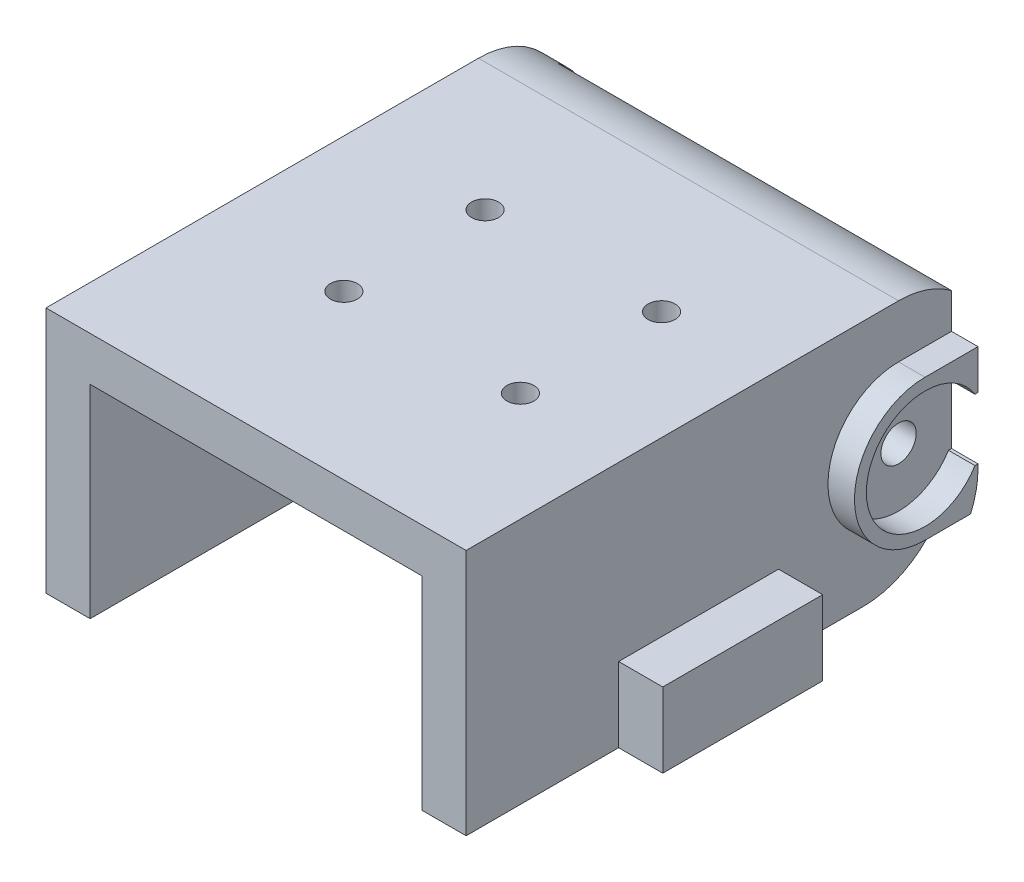
from build123d import *

# Parameters (mm, degrees)
SKETCH1_W           = 47.6
SKETCH1_H           = 28
BOSS_EXTRUDE1_DEPTH = 55
SKETCH3_R           = 2
CUT_EXTRUDE1_DEPTH  = 3
SKETCH4_W           = 18.116069914
SKETCH4_H           = 8.463303816
BOSS_EXTRUDE2_DEPTH = 5
BOSS_EXTRUDE4_DEPTH = 3
BOSS_EXTRUDE5_START = 3
BOSS_EXTRUDE5_DEPTH = 3
SKETCH8_W           = 3
SKETCH8_H           = 28
BOSS_EXTRUDE7_DEPTH = 4
FILLET1_R           = 10
FILLET2_R           = 10
SKETCH9_R           = 1.530150167
CUT_EXTRUDE2_DEPTH  = 69.106093707
SKETCH10_W          = 37.6
SKETCH10_H          = 23
CUT_EXTRUDE4_DEPTH  = 40


with BuildPart() as part:
    # Sketch1 → Boss-Extrude1 (new body)
    with BuildSketch(Plane.XY):
        Rectangle(SKETCH1_W, SKETCH1_H)
    extrude(amount=BOSS_EXTRUDE1_DEPTH)

    # Sketch3 → Cut-Extrude1 (cut)
    with BuildSketch(Plane(origin=(23.8, 0, 0), x_dir=(0, 0, -1), z_dir=(1, 0, 0))):
        with Locations((-6, 0)):
            Circle(SKETCH3_R)
    extrude(amount=-CUT_EXTRUDE1_DEPTH, mode=Mode.SUBTRACT)

    # Sketch4 → Boss-Extrude2 (add)
    with BuildSketch(Plane(origin=(23.8, 0, 0), x_dir=(0, 0, -1), z_dir=(1, 0, 0))):
        with Locations((-28.659392832, -9.768348092)):
            Rectangle(SKETCH4_W, SKETCH4_H)
    extrude(amount=BOSS_EXTRUDE2_DEPTH)

    # Sketch5 → Boss-Extrude4 (add)
    with BuildSketch(Plane(origin=(23.8, 0, 0), x_dir=(0, 0, -1), z_dir=(1, 0, 0))):
        with BuildLine():
            Line((-0.345576953, 3.5), (0, 3.5))
            Line((0, 3.5), (0, 8))
            Line((0, 8), (-6, 8))
            ThreePointArc((-6, 8), (-14, 0), (-6, -8))
            Line((-6, -8), (0, -8))
            Line((0, -8), (0, -3.5))
            Line((0, -3.5), (-0.345576953, -3.5))
            ThreePointArc((-0.345576953, -3.5), (-12.65, 0), (-0.345576953, 3.5))
        make_face()
    extrude(amount=BOSS_EXTRUDE4_DEPTH)

    # Sketch6 → Boss-Extrude5 (add)
    with BuildSketch(Plane.ZY.offset(23.8).offset(BOSS_EXTRUDE5_START)):
        with BuildLine():
            Line((-3.367496998, 3.5), (-1.193747285, 3.5))
            ThreePointArc((-1.193747285, 3.5), (14, 0), (-1.193747285, -3.5))
            Line((-1.193747285, -3.5), (-3.367496998, -3.5))
            ThreePointArc((-3.367496998, -3.5), (16, 0), (-3.367496998, 3.5))
        make_face()
    extrude(amount=-BOSS_EXTRUDE5_DEPTH)

    # Sketch8 → Boss-Extrude7 (add)
    with BuildSketch(Plane(origin=(0, 0, 0), x_dir=(-1, 0, 0), z_dir=(0, 0, -1))):
        with Locations((22.3, 0)):
            Rectangle(SKETCH8_W, SKETCH8_H)
    extrude(amount=BOSS_EXTRUDE7_DEPTH)

    # Fillet1
    fillet1_edges = [part.edges().sort_by_distance(p)[0] for p in [
        (-22.3, 14, -4),
        (1.5, -14, 0),
    ]]
    fillet(fillet1_edges, radius=FILLET1_R)

    # Fillet2
    fillet2_edges = [part.edges().sort_by_distance(p)[0] for p in [
        (-22.3, -14, -4),
    ]]
    fillet(fillet2_edges, radius=FILLET2_R)

    # Sketch9 → Cut-Extrude2 (cut, through all)
    with BuildSketch(Plane(origin=(0, 14, 0), x_dir=(1, 0, 0), z_dir=(0, 1, 0))):
        with Locations((-8.55, -20.5)):
            Circle(SKETCH9_R)
        with Locations((11.45, -20.5)):
            Circle(SKETCH9_R)
        with Locations((11.45, -36.5)):
            Circle(SKETCH9_R)
        with Locations((-8.55, -36.5)):
            Circle(SKETCH9_R)
    extrude(amount=-CUT_EXTRUDE2_DEPTH, mode=Mode.SUBTRACT)

    # Sketch10 → Cut-Extrude4 (cut)
    with BuildSketch(Plane.XY.offset(55)):
        with Locations((0, -2.5)):
            Rectangle(SKETCH10_W, SKETCH10_H)
    extrude(amount=-CUT_EXTRUDE4_DEPTH, mode=Mode.SUBTRACT)


solid = part.part
